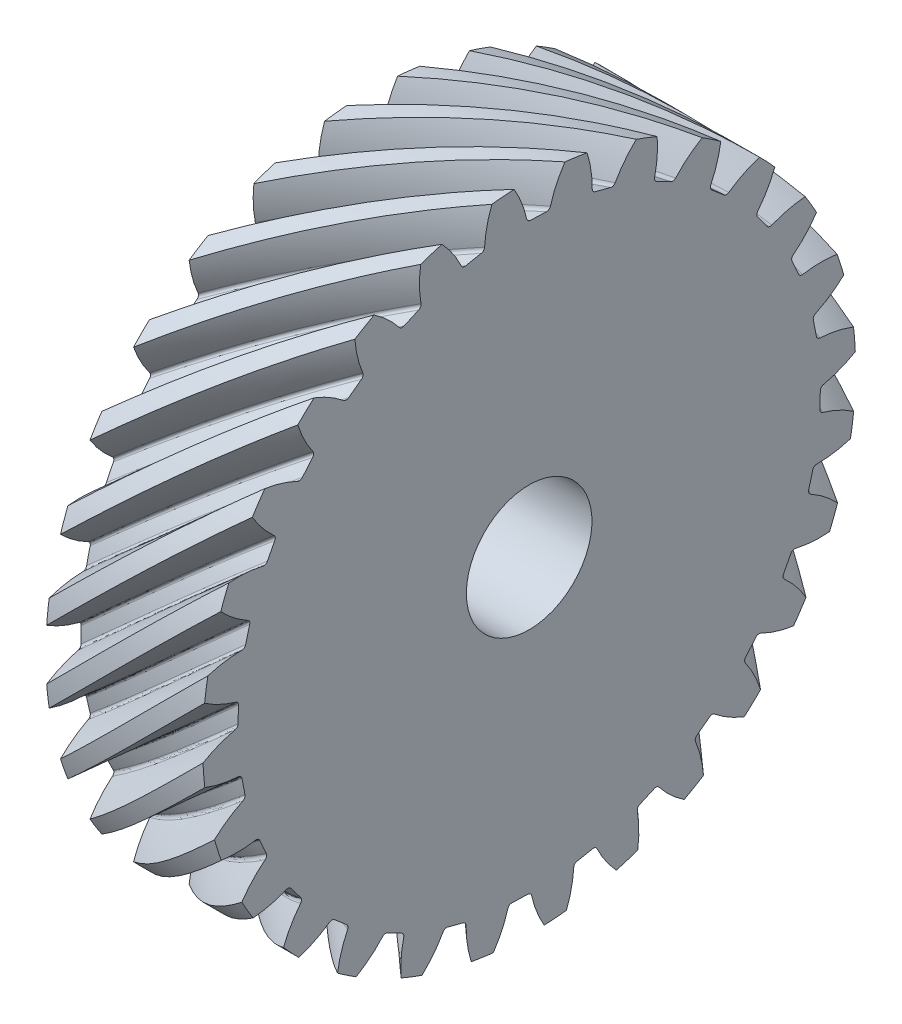
from build123d import *

# Parameters (mm, degrees)
BASPROSKE_W            = 25
BASPROSKE_H            = 51.997474683
TOOTHCUTLH_PITCH       = 326.709768939
TOOTHCUTLH_HEIGHT      = 25
TOOTHCUTLH_RADIUS      = 51.997474683
TOOTHCUTLH_START_ANGLE = -90
TEETHCUTSLH_COUNT      = 28
TEETHCUTSLH_ANGLE      = 347.142857143
BORSKE_R               = 10
BORE_DEPTH             = 62.5000025


with BuildPart() as part:
    # BasProSke → Base-Revolve (revolve)
    with BuildSketch(Plane(origin=(0, 0, 0), x_dir=(1, 0, 0), z_dir=(0, 1, 0)), mode=Mode.PRIVATE) as base_revolve_sk:
        with Locations((12.5, 25.998737342)):
            Rectangle(BASPROSKE_W, BASPROSKE_H)
    revolve(base_revolve_sk.sketch.rotate(Axis((-10, 0, 0), (1, 0, 0)), 180), axis=Axis((-10, 0, 0), (1, 0, 0)))

    # ToothCutLH: sweep along a helix
    with BuildLine() as toothcutlh_path:
        add(Helix(TOOTHCUTLH_PITCH, TOOTHCUTLH_HEIGHT, TOOTHCUTLH_RADIUS, center=(0, 0, 0), direction=(1, 0, 0), lefthand=True, mode=Mode.PRIVATE).rotate(Axis((0, 0, 0), (1, 0, 0)), TOOTHCUTLH_START_ANGLE))
    # TooCutSkeRH<3> → ToothCutLH (sweep, cut)
    with BuildSketch(Plane(origin=(0, 0, 0), x_dir=(0, 0, -1), z_dir=(1, 0, 0))):
        with BuildLine():
            ThreePointArc((1.266276298, 46.355182586), (0, 46.372474683), (-1.266276298, 46.355182586))
            ThreePointArc((-1.266276298, 46.355182586), (-1.660564758, 46.481349008), (-1.889892603, 46.826008397))
            ThreePointArc((-1.889892603, 46.826008397), (-3.151620001, 50.237697301), (-5.09139907, 53.314844415))
            ThreePointArc((-5.09139907, 53.314844415), (0, 53.557398924), (5.09139907, 53.314844415))
            ThreePointArc((5.09139907, 53.314844415), (3.151620001, 50.237697301), (1.889892603, 46.826008397))
            ThreePointArc((1.889892603, 46.826008397), (1.660564758, 46.481349008), (1.266276298, 46.355182586))
        make_face()
    toothcutlh = sweep(path=toothcutlh_path.line, is_frenet=True, mode=Mode.SUBTRACT)

    # TeethCutsLH: ToothCutLH ×28 about axis
    teethcutslh_axis = Axis((-10, 0, 0), (1, 0, 0))
    for i in range(1, TEETHCUTSLH_COUNT):
        add(toothcutlh.rotate(teethcutslh_axis, i * TEETHCUTSLH_ANGLE / (TEETHCUTSLH_COUNT - 1)), mode=Mode.SUBTRACT)

    # BorSke → Bore (cut, symmetric)
    with BuildSketch(Plane(origin=(0, 0, 0), x_dir=(0, 0, -1), z_dir=(1, 0, 0))):
        with Locations(Location((0, 0, 0), (0, 0, 180))):
            Circle(BORSKE_R)
    extrude(amount=BORE_DEPTH, both=True, mode=Mode.SUBTRACT)


solid = part.part
